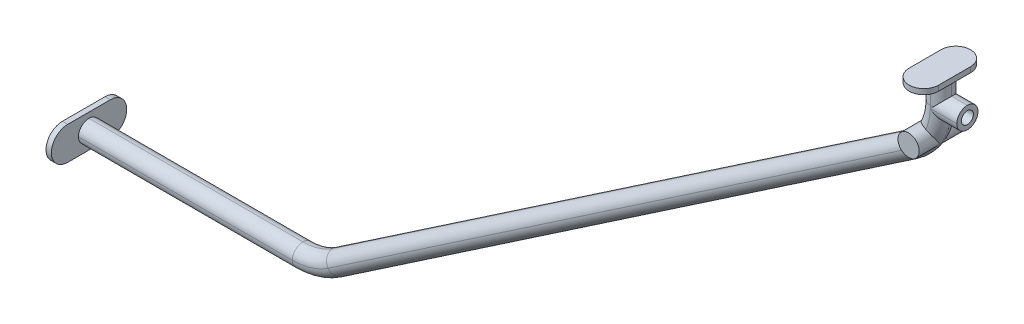
from build123d import *

# Parameters (mm, degrees)
BOSS_EXTRUDE1_DEPTH      = 10
BOSS_EXTRUDE1_DEPTH_BACK = 10
FILLET1_R                = 10
BOSS_EXTRUDE2_DEPTH      = 5
BOSS_EXTRUDE4_DEPTH      = 5
BOSS_EXTRUDE5_DEPTH      = 10
BOSS_EXTRUDE5_DEPTH_BACK = 10
SKETCH5_W                = 19.29861945
SKETCH5_H                = 20
FILLET2_R                = 10
SKETCH6_R                = 5.667563513
CUT_EXTRUDE1_DEPTH       = 10
BOSS_EXTRUDE6_REACH      = 969.104
SKETCH8_R                = 10
BOSS_EXTRUDE7_DEPTH      = 1019
CUT_EXTRUDE2_DEPTH       = 280
CUT_EXTRUDE2_DEPTH_BACK  = 1444
SKETCH9_W                = 1278.782045746
SKETCH9_H                = 255.439139792


with BuildPart() as part:
    # Sketch1 → Boss-Extrude1 (new, two sides: drawn at the far end of the back side and taken through both)
    with BuildSketch(Plane.XY.offset(-BOSS_EXTRUDE1_DEPTH_BACK)):
        with BuildLine():
            Line((607.162397096, -54.001902352), (607.162397096, -80.555486908))
            ThreePointArc((607.162397096, -80.555486908), (601.33801245, -103.975884173), (585.221796773, -121.93990535))
            Line((585.221796773, -121.93990535), (44.469579136, -488.579891421))
            ThreePointArc((44.469579136, -488.579891421), (31.086334914, -494.993071884), (16.410179458, -497.19547298))
            Line((16.410179458, -497.19547298), (-190, -497.19547298))
            Line((-190, -497.19547298), (-190, -517.19547298))
            Line((-190, -517.19547298), (16.410179458, -517.19547298))
            ThreePointArc((16.410179458, -517.19547298), (36.956797096, -514.112111446), (55.693339007, -505.133658798))
            Line((55.693339007, -505.133658798), (596.445556644, -138.493672726))
            ThreePointArc((596.445556644, -138.493672726), (619.008258592, -113.34404308), (627.162397096, -80.555486908))
            Line((627.162397096, -80.555486908), (627.162397096, -54.001902352))
            Line((627.162397096, -54.001902352), (607.162397096, -54.001902352))
        make_face()
    extrude(amount=BOSS_EXTRUDE1_DEPTH + BOSS_EXTRUDE1_DEPTH_BACK)

    # Fillet1
    fillet1_edges = [part.edges().sort_by_distance(p)[0] for p in [
        (627.162397096, -67.27869463, 10),
        (619.008258592, -113.34404308, 10),
        (326.069447825, -321.813665762, 10),
        (36.956797096, -514.112111446, 10),
        (627.162397096, -67.27869463, -10),
        (619.008258592, -113.34404308, -10),
        (326.069447825, -321.813665762, -10),
        (36.956797096, -514.112111446, -10),
        (607.162397096, -67.27869463, -10),
        (601.33801245, -103.975884173, -10),
        (314.845687955, -305.259898386, -10),
        (31.086334914, -494.993071884, -10),
        (607.162397096, -67.27869463, 10),
        (601.33801245, -103.975884173, 10),
        (314.845687955, -305.259898386, 10),
        (31.086334914, -494.993071884, 10),
        (-86.794910271, -517.19547298, 10),
        (-86.794910271, -517.19547298, -10),
        (-86.794910271, -497.19547298, -10),
        (-86.794910271, -497.19547298, 10),
    ]]
    fillet(fillet1_edges, radius=FILLET1_R - 0.0001)  # a hair under: the kernel refuses the full size

    # Sketch2 → Boss-Extrude2 (add)
    with BuildSketch(Plane.ZY.offset(190)):
        with BuildLine():
            Line((-19.996493956, -492.042114256), (19.996493956, -492.042114256))
            ThreePointArc((19.996493956, -492.042114256), (35.507762302, -507.553382602), (19.996493956, -523.064650948))
            Line((19.996493956, -523.064650948), (-19.996493956, -523.064650948))
            ThreePointArc((-19.996493956, -523.064650948), (-35.507762302, -507.553382602), (-19.996493956, -492.042114256))
        make_face()
    extrude(amount=-BOSS_EXTRUDE2_DEPTH)

    # Sketch4 → Boss-Extrude4 (add)
    with BuildSketch(Plane(origin=(0, -54.001902352, 0), x_dir=(1, 0, 0), z_dir=(0, 1, 0))):
        with BuildLine():
            Line((631.039513232, 13.873455475), (631.039513232, -16.126544525))
            ThreePointArc((631.039513232, -16.126544525), (617.162397096, -30.003660661), (603.28528096, -16.126544525))
            Line((603.28528096, -16.126544525), (603.28528096, 13.873455475))
            ThreePointArc((603.28528096, 13.873455475), (617.162397096, 27.75057161), (631.039513232, 13.873455475))
        make_face()
    extrude(amount=-BOSS_EXTRUDE4_DEPTH)

    # Sketch5 → Boss-Extrude5 (add, two sides: drawn at the far end of the back side and taken through both)
    with BuildSketch(Plane.XY.offset(-BOSS_EXTRUDE5_DEPTH_BACK)):
        with Locations((632.318910509, -83.084882275)):
            Rectangle(SKETCH5_W, SKETCH5_H)
    extrude(amount=BOSS_EXTRUDE5_DEPTH + BOSS_EXTRUDE5_DEPTH_BACK)

    # Fillet2
    fillet2_edges = [part.edges().sort_by_distance(p)[0] for p in [
        (632.318910509, -93.084882275, -10),
    ]]
    fillet(fillet2_edges, radius=FILLET2_R)
    fillet2_2_edges = [part.edges().sort_by_distance(p)[0] for p in [
        (632.318910509, -93.084882275, 10),
    ]]
    fillet(fillet2_2_edges, radius=FILLET2_R - 0.0001)  # a hair under: the kernel refuses the full size
    fillet2_3_edges = [part.edges().sort_by_distance(p)[0] for p in [
        (632.318910509, -73.084882275, -10),
    ]]
    fillet(fillet2_3_edges, radius=FILLET2_R - 0.0001)  # a hair under: the kernel refuses the full size
    fillet2_4_edges = [part.edges().sort_by_distance(p)[0] for p in [
        (632.318910509, -73.084882275, 10),
    ]]
    fillet(fillet2_4_edges, radius=FILLET2_R)

    # Sketch6 → Cut-Extrude1 (cut)
    with BuildSketch(Plane(origin=(641.968220234, 0, 0), x_dir=(0, 0, -1), z_dir=(1, 0, 0))):
        with Locations((0, -83.084882275)):
            Circle(SKETCH6_R)
    extrude(amount=-CUT_EXTRUDE1_DEPTH, mode=Mode.SUBTRACT)

    # Sketch7 → Boss-Extrude6 (add, up to next)
    with BuildSketch(Plane.ZY.offset(-622.669600784), mode=Mode.PRIVATE) as boss_extrude6_sk1:
        with BuildLine():
            Line((8.346898079, -77.577678587), (8.346898079, -80.555486908))
            add(Edge.make_bspline(
                [(8.346898079, -80.555486908), (8.346898079, -81.982172187), (8.316696448, -83.410187507), (8.220943403, -85.554432266), (8.180517355, -86.269555217), (8.105441743, -87.342875409), (8.077480522, -87.707593017), (8.016628456, -88.431395263), (7.983579243, -88.792907334), (7.947693147, -89.153998656)],
                knots=[0, 0, 0, 0, 0.5, 0.5, 0.75, 0.75, 0.875, 0.875, 1, 1, 1, 1], degree=3))
            ThreePointArc((7.947693147, -89.153998656), (9.473038886, -86.288245237), (10, -83.084882275))
            ThreePointArc((10, -83.084882275), (9.577812401, -80.209902344), (8.346898079, -77.577678587))
        make_face()
    boss_extrude6_tool1 = extrude(boss_extrude6_sk1.sketch, amount=BOSS_EXTRUDE6_REACH, mode=Mode.PRIVATE) - part.part
    # Sketch7 → Boss-Extrude6 (add, up to next)
    with BuildSketch(Plane.ZY.offset(-622.669600784), mode=Mode.PRIVATE) as boss_extrude6_sk2:
        with BuildLine():
            Line((-8.346898079, -80.555486908), (-8.346898079, -77.577678587))
            ThreePointArc((-8.346898079, -77.577678587), (-9.577812401, -80.209902344), (-10, -83.084882275))
            ThreePointArc((-10, -83.084882275), (-9.473038886, -86.288245237), (-7.947693147, -89.153998656))
            add(Edge.make_bspline(
                [(-7.947693147, -89.153998656), (-8.018512425, -88.441404381), (-8.078109125, -87.730146084), (-8.179099861, -86.293184501), (-8.219875886, -85.575121381), (-8.316449214, -83.42203878), (-8.346898079, -81.988108603), (-8.346898079, -80.555486908)],
                knots=[0, 0, 0, 0, 0.25, 0.25, 0.5, 0.5, 1, 1, 1, 1], degree=3))
        make_face()
    boss_extrude6_tool2 = extrude(boss_extrude6_sk2.sketch, amount=BOSS_EXTRUDE6_REACH, mode=Mode.PRIVATE) - part.part
    add(boss_extrude6_tool1.solids().sort_by_distance((622.669601, -83.365706, 8.954247))[0])
    add(boss_extrude6_tool2.solids().sort_by_distance((622.669601, -83.365642, -8.95425))[0])

    # Sketch8 → Boss-Extrude7 (add)
    with BuildSketch(Plane(origin=(199.991553268, -559.852678749, 969.030069289), x_dir=(-1, 0, 0), z_dir=(0, 0, -1))):
        with Locations((-408.53596746, 448.543088546)):
            Circle(SKETCH8_R)
    extrude(amount=BOSS_EXTRUDE7_DEPTH)

    # Sketch9 → Cut-Extrude2 (cut, two sides: drawn at the far end of the back side and taken through both)
    with BuildSketch(Plane(origin=(631.039513232, 0, 0), x_dir=(0, 0, -1), z_dir=(1, 0, 0)).offset(-CUT_EXTRUDE2_DEPTH_BACK)):
        with Locations((661.306648268, -219.998567208)):
            Rectangle(SKETCH9_W, SKETCH9_H)
        with Locations((-661.306648268, -219.998567208)):
            Rectangle(SKETCH9_W, SKETCH9_H)
    extrude(amount=CUT_EXTRUDE2_DEPTH + CUT_EXTRUDE2_DEPTH_BACK, mode=Mode.SUBTRACT)


solid = part.part
